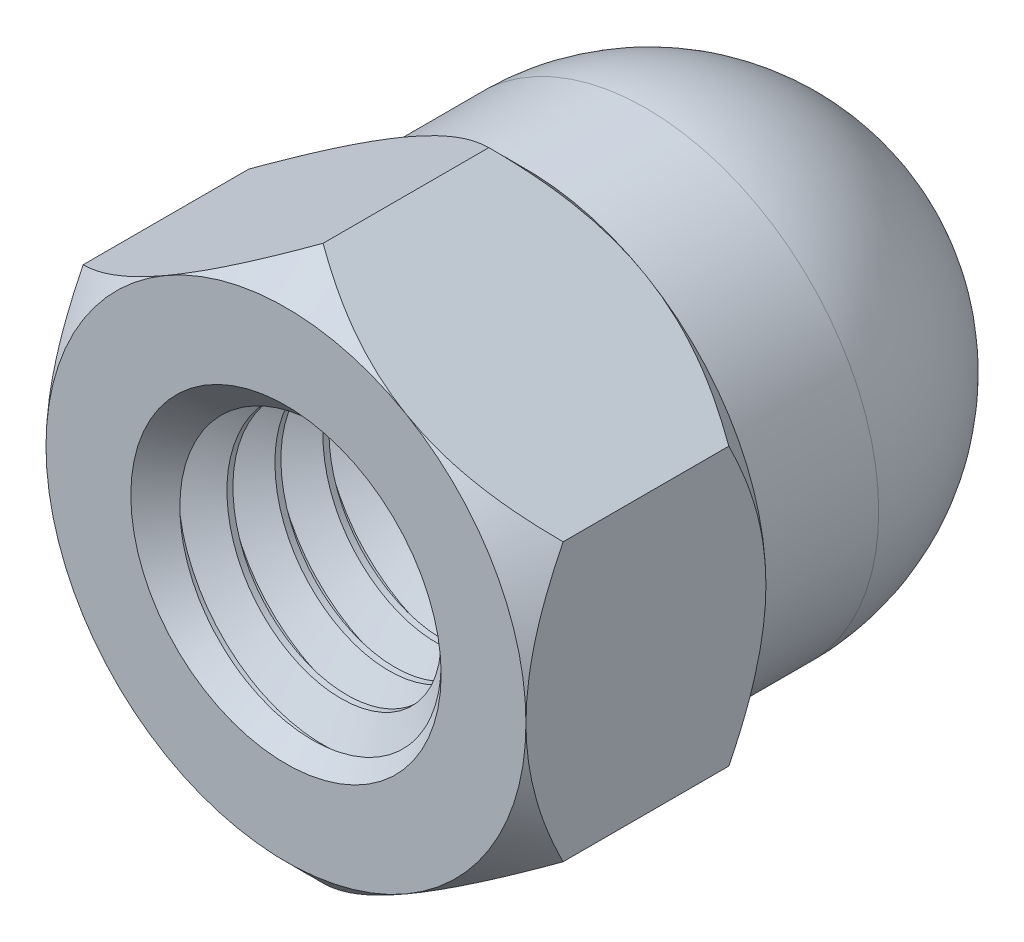
from build123d import *

# Parameters (mm, degrees)
BOSS_EXTRUDE2_DEPTH          = 4
SKETCH8_OUTSIDE_W            = 29.178
SKETCH8_OUTSIDE_H            = 30.416
SKETCH8_OUTSIDE_R            = 4
CUT_EXTRUDE3_DEPTH           = 8.302967433
CUT_EXTRUDE3_DRAFT           = -45
SKETCH9_OUTSIDE_W            = 29.178
SKETCH9_OUTSIDE_H            = 30.416
SKETCH9_OUTSIDE_R            = 4
CUT_EXTRUDE4_DEPTH           = 8.302967433
CUT_EXTRUDE4_DRAFT           = 45
SWEEP1_PITCH                 = 0.8
SKETCH15_R                   = 2.58660254
CUT_EXTRUDE5_OTHER_WAY_DEPTH = 12.718930674
CUT_EXTRUDE5_OTHER_WAY_TAPER = -45


with BuildPart() as part:
    # Sketch7 → Boss-Extrude2 (new body)
    with BuildSketch(Plane.XY.offset(5)):
        Polygon((0, 4.618802154), (-4, 2.309401077), (-4, -2.309401077), (0, -4.618802154), (4, -2.309401077), (4, 2.309401077), align=None)
    extrude(amount=-BOSS_EXTRUDE2_DEPTH)


with BuildPart() as cut_extrude3_tool:
    # Sketch8 outside → Cut-Extrude3 (with draft: the straight prism first)
    with BuildSketch(Plane.XY.offset(5)):
        Rectangle(SKETCH8_OUTSIDE_W, SKETCH8_OUTSIDE_H)
        Circle(SKETCH8_OUTSIDE_R, mode=Mode.SUBTRACT)
    extrude(amount=-CUT_EXTRUDE3_DEPTH)
    # Cut-Extrude3: the draft: its side faces are tilted about the plane it starts from
    cut_extrude3_sides = [cut_extrude3_tool.faces().sort_by_distance(p)[0] for p in [
        (0, -15.208, 0.848516283),
        (14.589, 0, 0.848516283),
        (0, 15.208, 0.848516283),
        (-14.589, 0, 0.848516283),
        (-4, 0, 0.848516283),
    ]]
    draft(cut_extrude3_sides, Plane.XY.offset(5), CUT_EXTRUDE3_DRAFT)


with BuildPart() as part_1:
    add(part.part)

    # Cut-Extrude3: cut by cut_extrude3_tool
    add(cut_extrude3_tool.part, mode=Mode.SUBTRACT)


with BuildPart() as cut_extrude4_tool:
    # Sketch9 outside → Cut-Extrude4 (with draft: the straight prism first)
    with BuildSketch(Plane.XY.offset(1)):
        Rectangle(SKETCH9_OUTSIDE_W, SKETCH9_OUTSIDE_H)
        Circle(SKETCH9_OUTSIDE_R, mode=Mode.SUBTRACT)
    extrude(amount=CUT_EXTRUDE4_DEPTH)
    # Cut-Extrude4: the draft: its side faces are tilted about the plane it starts from
    cut_extrude4_sides = [cut_extrude4_tool.faces().sort_by_distance(p)[0] for p in [
        (0, -15.208, 5.151483717),
        (14.589, 0, 5.151483717),
        (0, 15.208, 5.151483717),
        (-14.589, 0, 5.151483717),
        (-4, 0, 5.151483717),
    ]]
    draft(cut_extrude4_sides, Plane.XY.offset(1), CUT_EXTRUDE4_DRAFT)


with BuildPart() as part_2:
    add(part_1.part)

    # Cut-Extrude4: cut by cut_extrude4_tool
    add(cut_extrude4_tool.part, mode=Mode.SUBTRACT)

    # Sketch10 → Revolve1 (revolve)
    with BuildSketch(Plane(origin=(0, 0, 0), x_dir=(0, 0, -1), z_dir=(1, 0, 0))):
        with BuildLine():
            Line((1, 4), (-1, 4))
            Line((-1, 4), (-1, 0))
            Line((-1, 0), (5, 0))
            ThreePointArc((5, 0), (3.828427125, 2.828427125), (1, 4))
        make_face()
    revolve(axis=Axis((0, 0, -5), (0, 0, 1)))

    # Sketch11 → Cut-Revolve1 (revolve, cut)
    with BuildSketch(Plane(origin=(0, 0, 0), x_dir=(0, 0, -1), z_dir=(1, 0, 0)), mode=Mode.PRIVATE) as cut_revolve1_sk:
        Polygon((-5, 0), (-5, 2.5), (2.21, 2.5), (2.879872981, 0), align=None)
    revolve(cut_revolve1_sk.sketch.rotate(Axis((0, 0, -5), (0, 0, 1)), 90), axis=Axis((0, 0, -5), (0, 0, 1)), mode=Mode.SUBTRACT)

    # Sweep1: the profile of Sketch13 screwed along a right-hand helix of 10.0125 turns, 8 arcs to a turn; built about Z, then put on its axis
    sweep1_z = Axis((0, 0, 0), (0, 0, 1))
    sweep1_corners = [(2.54330127, 0, -0.725), (1.980384758, 0, -0.4), (1.980384758, 0, -0.3), (2.54330127, 0, 0.025)]
    with BuildLine(mode=Mode.PRIVATE) as sweep1_profile:
        Line(sweep1_corners[0], sweep1_corners[1])
        Line(sweep1_corners[1], sweep1_corners[2])
        Line(sweep1_corners[2], sweep1_corners[3])
        Line(sweep1_corners[3], sweep1_corners[0])
    sweep1_cap = Face(sweep1_profile.wire())
    sweep1_turn_angles = [0, 22.5, 45, 67.5, 90, 112.5, 135, 157.5, 180, 202.5, 225, 247.5, 270, 292.5, 315, 337.5, 360]
    sweep1_turn_weights = [1, 0.9238795325112867, 1, 0.9238795325112867, 1, 0.9238795325112867, 1, 0.9238795325112867, 1, 0.9238795325112867, 1, 0.9238795325112867, 1, 0.9238795325112867, 1, 0.9238795325112867, 1]
    sweep1_turn_rails = [Edge.make_bspline([Vector(p[0], p[1], 0).rotate(sweep1_z, sweep1_turn_angles[k]) / sweep1_turn_weights[k] + Vector(0, 0, p[2] + SWEEP1_PITCH * sweep1_turn_angles[k] / 360) for k in range(17)], [0, 0, 0, 1, 1, 2, 2, 3, 3, 4, 4, 5, 5, 6, 6, 7, 7, 8, 8, 8], 2, sweep1_turn_weights) for p in sweep1_corners]
    sweep1_turn_sides = [Face.make_surface_from_curves(sweep1_turn_rails[p[0]], sweep1_turn_rails[p[1]]) for p in [(0, 1), (1, 2), (2, 3), (3, 0)]]
    sweep1_last_angles = [3600, 3602.25, 3604.5]
    sweep1_last_weights = [1, 0.9992290362407218, 1]
    sweep1_last_rails = [Edge.make_bspline([Vector(p[0], p[1], 0).rotate(sweep1_z, sweep1_last_angles[k]) / sweep1_last_weights[k] + Vector(0, 0, p[2] + SWEEP1_PITCH * sweep1_last_angles[k] / 360) for k in range(3)], [0, 0, 0, 1, 1, 1], 2, sweep1_last_weights) for p in sweep1_corners]
    sweep1_last_sides = [Face.make_surface_from_curves(sweep1_last_rails[p[0]], sweep1_last_rails[p[1]]) for p in [(0, 1), (1, 2), (2, 3), (3, 0)]]
    sweep1 = Plane(origin=(0, 0, 5), x_dir=(0, 1, 0), z_dir=(0, 0, -1)) * Solid(Shell([*[p.moved(Location((0, 0, SWEEP1_PITCH * i))) for i in range(10) for p in sweep1_turn_sides], *sweep1_last_sides, sweep1_cap, sweep1_cap.rotate(sweep1_z, 3604.5).moved(Location((0, 0, SWEEP1_PITCH * 3604.5 / 360)))]))
    add(sweep1)

    # Sketch14 → Cut-Revolve4 (revolve, cut)
    with BuildSketch(Plane(origin=(0, 0, 0), x_dir=(0, 0, -1), z_dir=(1, 0, 0)), mode=Mode.PRIVATE) as cut_revolve4_sk:
        with BuildLine():
            Line((1, 3.879619644), (-1, 3.879619644))
            Line((-1, 3.879619644), (-1, 4))
            Line((-1, 4), (1, 4))
            Line((1, 4), (5, 4))
            Line((5, 4), (5.240760712, 4))
            Line((5.240760712, 4), (5.240760712, 1.25))
            Line((5.240760712, 1.25), (5.240760712, 0))
            Line((5.240760712, 0), (5, 0))
            ThreePointArc((5, 0), (3.786191333, 2.750395813), (1, 3.879619644))
        make_face()
    revolve(cut_revolve4_sk.sketch.rotate(Axis((0, 0, -5), (0, 0, 1)), 270), axis=Axis((0, 0, -5), (0, 0, 1)), mode=Mode.SUBTRACT)

    # Cut-Extrude5 cone 1 section (through the dimple's axis) → Cut-Extrude5 (revolve, cut)
    with BuildSketch(Plane(origin=(0, 0, 5), x_dir=(0, -1, 0), z_dir=(1, 0, 0))):
        Polygon((0, 0), (2.58660254, 0), (0, 2.58660254), align=None)
    revolve(axis=Axis((0, 0, 5), (0, 0, -1)), mode=Mode.SUBTRACT)

    # Sketch15 → Cut-Extrude5 other way (cut)
    with BuildSketch(Plane.XY.offset(5)):
        Circle(SKETCH15_R)
    extrude(amount=CUT_EXTRUDE5_OTHER_WAY_DEPTH, taper=CUT_EXTRUDE5_OTHER_WAY_TAPER, mode=Mode.SUBTRACT)


solid = part_2.part
